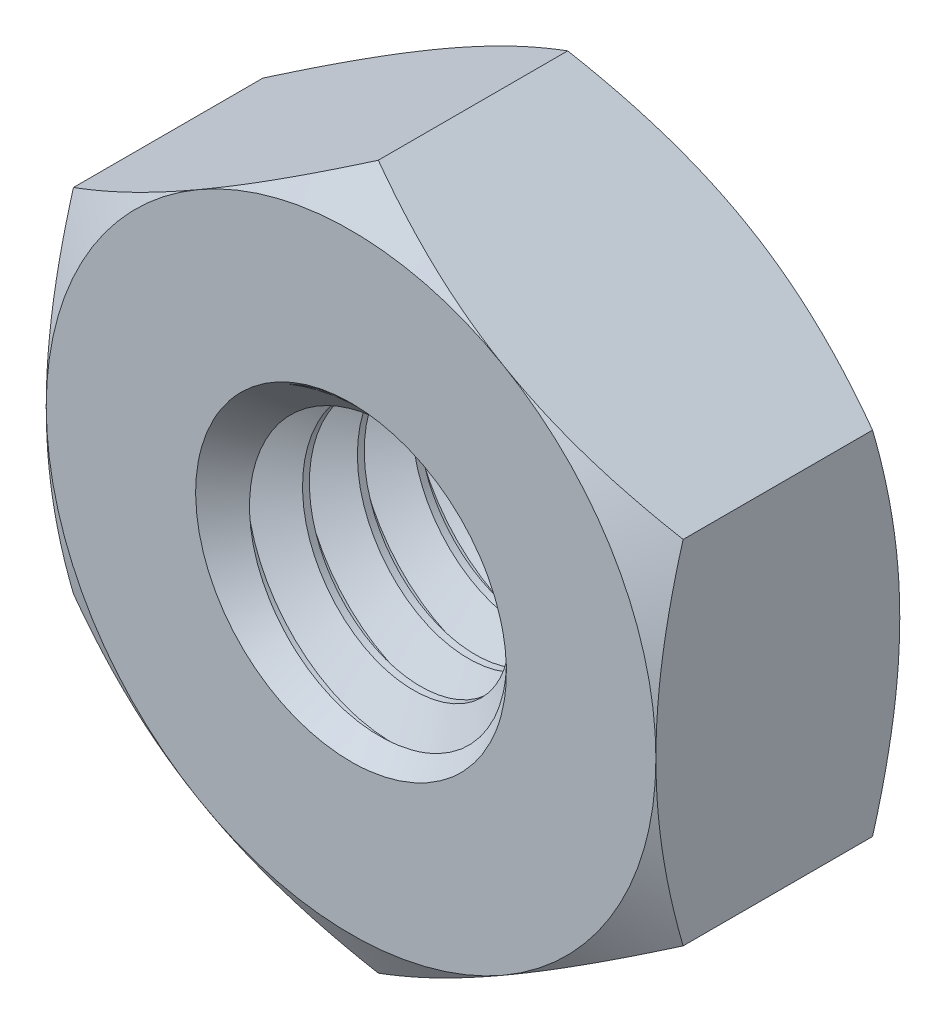
from build123d import *

# Parameters (mm, degrees)
BOSS_EXTRUDE1_DEPTH      = 1
BOSS_EXTRUDE1_DEPTH_BACK = 1
SKETCH2_R                = 1.25
SKETCH3_OUTSIDE_W        = 26.976
SKETCH3_OUTSIDE_H        = 27.75
SKETCH3_OUTSIDE_R        = 2.5
CUT_EXTRUDE1_DEPTH       = 5.310839052
CUT_EXTRUDE1_DRAFT       = -60
MIRROR1_COPY_1_SKETCH_W  = 26.976
MIRROR1_COPY_1_SKETCH_H  = 27.75
MIRROR1_COPY_1_SKETCH_R  = 2.5
MIRROR1_COPY_1_DEPTH     = 5.310839052
MIRROR1_COPY_1_DRAFT     = -60
SWEEP1_PITCH             = 0.45
SKETCH6_R                = 1.274356964
CUT_EXTRUDE2_DEPTH       = 5.544770438
SKETCH7_R                = 1.274356964
CUT_EXTRUDE3_DEPTH       = 5.310839157


with BuildPart() as part:
    # Sketch2 → Boss-Extrude1 (new, two sides: drawn at the far end of the back side and taken through both)
    with BuildSketch(Plane.XY.offset(-BOSS_EXTRUDE1_DEPTH_BACK)):
        Polygon((0, 2.886751346), (-2.5, 1.443375673), (-2.5, -1.443375673), (0, -2.886751346), (2.5, -1.443375673), (2.5, 1.443375673), align=None)
        Circle(SKETCH2_R, mode=Mode.SUBTRACT)
    extrude(amount=BOSS_EXTRUDE1_DEPTH + BOSS_EXTRUDE1_DEPTH_BACK)


with BuildPart() as cut_extrude1_tool:
    # Sketch3 outside → Cut-Extrude1 (with draft: the straight prism first)
    with BuildSketch(Plane.XY.offset(1)):
        Rectangle(SKETCH3_OUTSIDE_W, SKETCH3_OUTSIDE_H)
        Circle(SKETCH3_OUTSIDE_R, mode=Mode.SUBTRACT)
    extrude(amount=-CUT_EXTRUDE1_DEPTH)
    # Cut-Extrude1: the draft: its side faces are tilted about the plane it starts from
    cut_extrude1_sides = [cut_extrude1_tool.faces().sort_by_distance(p)[0] for p in [
        (0, -13.875, -1.655419526),
        (13.488, 0, -1.655419526),
        (0, 13.875, -1.655419526),
        (-13.488, 0, -1.655419526),
        (-2.5, 0, -1.655419526),
    ]]
    draft(cut_extrude1_sides, Plane.XY.offset(1), CUT_EXTRUDE1_DRAFT)


with BuildPart() as part_1:
    add(part.part)

    # Cut-Extrude1: cut by cut_extrude1_tool
    add(cut_extrude1_tool.part, mode=Mode.SUBTRACT)


with BuildPart() as mirror1_copy_1_tool:
    # Mirror1 copy 1 sketch → Mirror1 copy 1 (with draft: the straight prism first)
    with BuildSketch(Plane(origin=(0, 0, -1), x_dir=(1, 0, 0), z_dir=(0, 0, -1))):
        Rectangle(MIRROR1_COPY_1_SKETCH_W, MIRROR1_COPY_1_SKETCH_H)
        Circle(MIRROR1_COPY_1_SKETCH_R, mode=Mode.SUBTRACT)
    extrude(amount=-MIRROR1_COPY_1_DEPTH)
    # Mirror1 copy 1: the draft: its side faces are tilted about the plane it starts from
    mirror1_copy_1_sides = [mirror1_copy_1_tool.faces().sort_by_distance(p)[0] for p in [
        (0, -13.875, 1.655419526),
        (13.488, 0, 1.655419526),
        (0, 13.875, 1.655419526),
        (-13.488, 0, 1.655419526),
        (-2.5, 0, 1.655419526),
    ]]
    draft(mirror1_copy_1_sides, Plane(origin=(0, 0, -1), x_dir=(1, 0, 0), z_dir=(0, 0, -1)), MIRROR1_COPY_1_DRAFT)


with BuildPart() as part_2:
    add(part_1.part)

    # Mirror1 copy 1: cut by mirror1_copy_1_tool
    add(mirror1_copy_1_tool.part, mode=Mode.SUBTRACT)

    # Sweep1: the profile of Sketch4 screwed along a right-hand helix of 5.444444 turns, 6 arcs to a turn; built about Z, then put on its axis
    sweep1_z = Axis((0, 0, 0), (0, 0, 1))
    sweep1_corners = [(1.274356964, 0, -0.4078125), (0.957716426, 0, -0.225), (0.957716426, 0, -0.16875), (1.274356964, 0, 0.0140625)]
    with BuildLine(mode=Mode.PRIVATE) as sweep1_profile:
        Line(sweep1_corners[0], sweep1_corners[1])
        Line(sweep1_corners[1], sweep1_corners[2])
        Line(sweep1_corners[2], sweep1_corners[3])
        Line(sweep1_corners[3], sweep1_corners[0])
    sweep1_cap = Face(sweep1_profile.wire())
    sweep1_turn_angles = [0, 30, 60, 90, 120, 150, 180, 210, 240, 270, 300, 330, 360]
    sweep1_turn_weights = [1, 0.8660254037844387, 1, 0.8660254037844387, 1, 0.8660254037844387, 1, 0.8660254037844387, 1, 0.8660254037844387, 1, 0.8660254037844387, 1]
    sweep1_turn_rails = [Edge.make_bspline([Vector(p[0], p[1], 0).rotate(sweep1_z, sweep1_turn_angles[k]) / sweep1_turn_weights[k] + Vector(0, 0, p[2] + SWEEP1_PITCH * sweep1_turn_angles[k] / 360) for k in range(13)], [0, 0, 0, 1, 1, 2, 2, 3, 3, 4, 4, 5, 5, 6, 6, 6], 2, sweep1_turn_weights) for p in sweep1_corners]
    sweep1_turn_sides = [Face.make_surface_from_curves(sweep1_turn_rails[p[0]], sweep1_turn_rails[p[1]]) for p in [(0, 1), (1, 2), (2, 3), (3, 0)]]
    sweep1_last_angles = [1800, 1830, 1860, 1890, 1920, 1940, 1960]
    sweep1_last_weights = [1, 0.8660254037844387, 1, 0.8660254037844387, 1, 0.9396926207859491, 1]
    sweep1_last_rails = [Edge.make_bspline([Vector(p[0], p[1], 0).rotate(sweep1_z, sweep1_last_angles[k]) / sweep1_last_weights[k] + Vector(0, 0, p[2] + SWEEP1_PITCH * sweep1_last_angles[k] / 360) for k in range(7)], [0, 0, 0, 1, 1, 2, 2, 3, 3, 3], 2, sweep1_last_weights) for p in sweep1_corners]
    sweep1_last_sides = [Face.make_surface_from_curves(sweep1_last_rails[p[0]], sweep1_last_rails[p[1]]) for p in [(0, 1), (1, 2), (2, 3), (3, 0)]]
    sweep1 = Plane(origin=(0, 0, 1), x_dir=(0, 1, 0), z_dir=(0, 0, -1)) * Solid(Shell([*[p.moved(Location((0, 0, SWEEP1_PITCH * i))) for i in range(5) for p in sweep1_turn_sides], *sweep1_last_sides, sweep1_cap, sweep1_cap.rotate(sweep1_z, 1960).moved(Location((0, 0, SWEEP1_PITCH * 1960 / 360)))]))
    add(sweep1)

    # Sketch6 → Cut-Extrude2 (cut)
    with BuildSketch(Plane.XY.offset(1)):
        Circle(SKETCH6_R)
    extrude(amount=CUT_EXTRUDE2_DEPTH, mode=Mode.SUBTRACT)

    # Cut-Extrude2 cone 1 section (through the dimple's axis) → Cut-Extrude2 other way (revolve, cut)
    with BuildSketch(Plane(origin=(0, 0, 1), x_dir=(0, -1, 0), z_dir=(1, 0, 0))):
        Polygon((0, 0), (1.274356964, 0), (0, 1.274356964), align=None)
    revolve(axis=Axis((0, 0, 1), (0, 0, -1)), mode=Mode.SUBTRACT)

    # Sketch7 → Cut-Extrude3 (cut)
    with BuildSketch(Plane(origin=(0, 0, -1), x_dir=(-1, 0, 0), z_dir=(0, 0, -1))):
        Circle(SKETCH7_R)
    extrude(amount=CUT_EXTRUDE3_DEPTH, mode=Mode.SUBTRACT)

    # Cut-Extrude3 cone 1 section (through the dimple's axis) → Cut-Extrude3 other way (revolve, cut)
    with BuildSketch(Plane(origin=(0, 0, -1), x_dir=(0, 1, 0), z_dir=(1, 0, 0))):
        Polygon((0, 0), (1.274356964, 0), (0, 1.274356964), align=None)
    revolve(axis=Axis((0, 0, -1), (0, 0, 1)), mode=Mode.SUBTRACT)


solid = part_2.part
